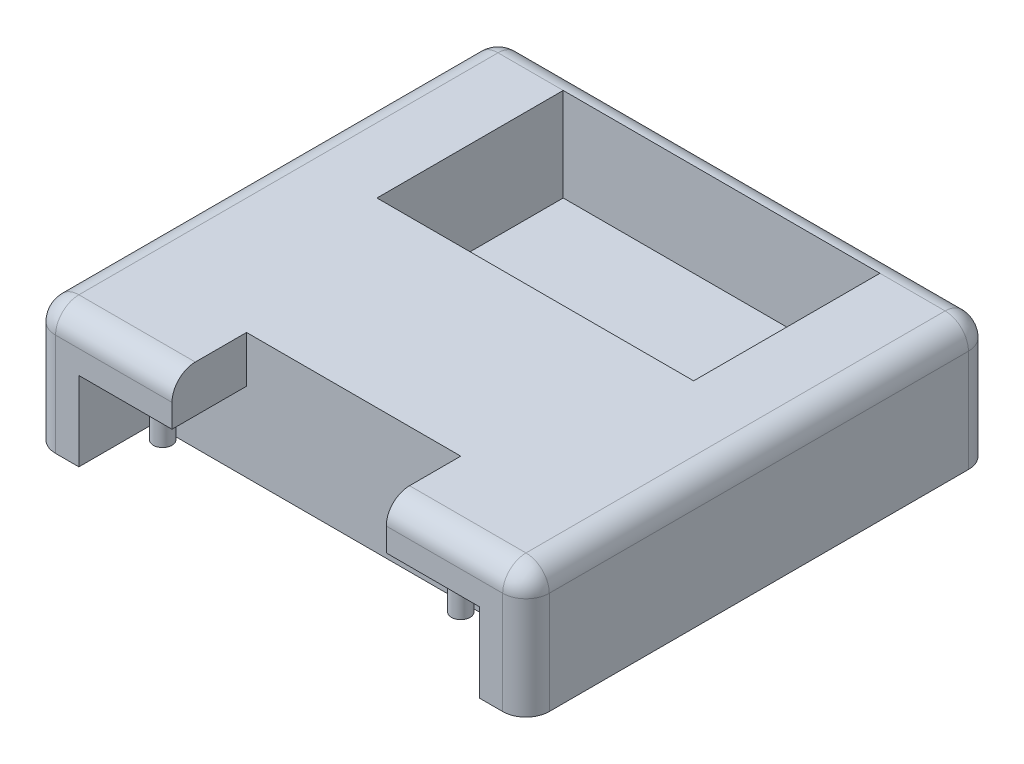
from build123d import *

# Parameters (mm, degrees)
SKETCH_2_W          = 106
SKETCH_2_H          = 100
EXTRUDE_1_DEPTH     = 10
SKETCH_3_R          = 2
EXTRUDE_2_DEPTH     = 10
EXTRUDE_3_DEPTH     = 17
SKETCH_5_W          = 68
SKETCH_5_H          = 40
CUT_EXTRUDE_1_DEPTH = 20
SKETCH_6_W          = 46
SKETCH_6_H          = 32
CUT_EXTRUDE_2_DEPTH = 20
FILLET_1_R          = 3
FILLET_2_R          = 5


with BuildPart() as part:
    # 草图2 → 凸台-拉伸1 (new body)
    with BuildSketch(Plane(origin=(0, 0, 0), x_dir=(1, 0, 0), z_dir=(0, 1, 0))):
        Rectangle(SKETCH_2_W, SKETCH_2_H)
    extrude(amount=EXTRUDE_1_DEPTH)

    # 草图3 → 凸台-拉伸2 (add)
    with BuildSketch(Plane.XZ):
        with Locations(Location((-32, 43, 0), (0, 0, 270))):
            Circle(SKETCH_3_R)
        with Locations(Location((32, 43, 0), (0, 0, 270))):
            Circle(SKETCH_3_R)
    extrude(amount=EXTRUDE_2_DEPTH)

    # 草图4 → 凸台-拉伸3 (add)
    with BuildSketch(Plane.XZ):
        Polygon((-53, 50), (-43, 50), (-43, 34), (43, 34), (43, 50), (53, 50), (53, -50), (43, -50), (-43, -50), (-53, -50), align=None)
    extrude(amount=EXTRUDE_3_DEPTH)

    # 草图5 → 切除-拉伸1 (cut)
    with BuildSketch(Plane(origin=(0, 10, 0), x_dir=(1, 0, 0), z_dir=(0, 1, 0))):
        with Locations((0, 25)):
            Rectangle(SKETCH_5_W, SKETCH_5_H)
    extrude(amount=-CUT_EXTRUDE_1_DEPTH, mode=Mode.SUBTRACT)

    # 草图6 → 切除-拉伸2 (cut)
    with BuildSketch(Plane.XZ):
        with Locations((0, 50)):
            Rectangle(SKETCH_6_W, SKETCH_6_H)
    extrude(amount=-CUT_EXTRUDE_2_DEPTH, mode=Mode.SUBTRACT)

    # 圆角1
    fillet_1_edges = [part.edges().sort_by_distance(p)[0] for p in [
        (-32, 0, 45),
        (32, 0, 45),
    ]]
    fillet(fillet_1_edges, radius=FILLET_1_R)

    # 圆角2
    fillet_2_edges = [part.edges().sort_by_distance(p)[0] for p in [
        (-53, 10, 0),
        (-38, 10, 50),
        (53, 10, 0),
        (38, 10, 50),
        (53, -3.5, 50),
        (-53, -3.5, 50),
        (-53, -3.5, -50),
        (53, -3.5, -50),
        (0, 10, -50),
    ]]
    fillet(fillet_2_edges, radius=FILLET_2_R - 0.0001)  # a hair under: the kernel refuses the full size


solid = part.part
